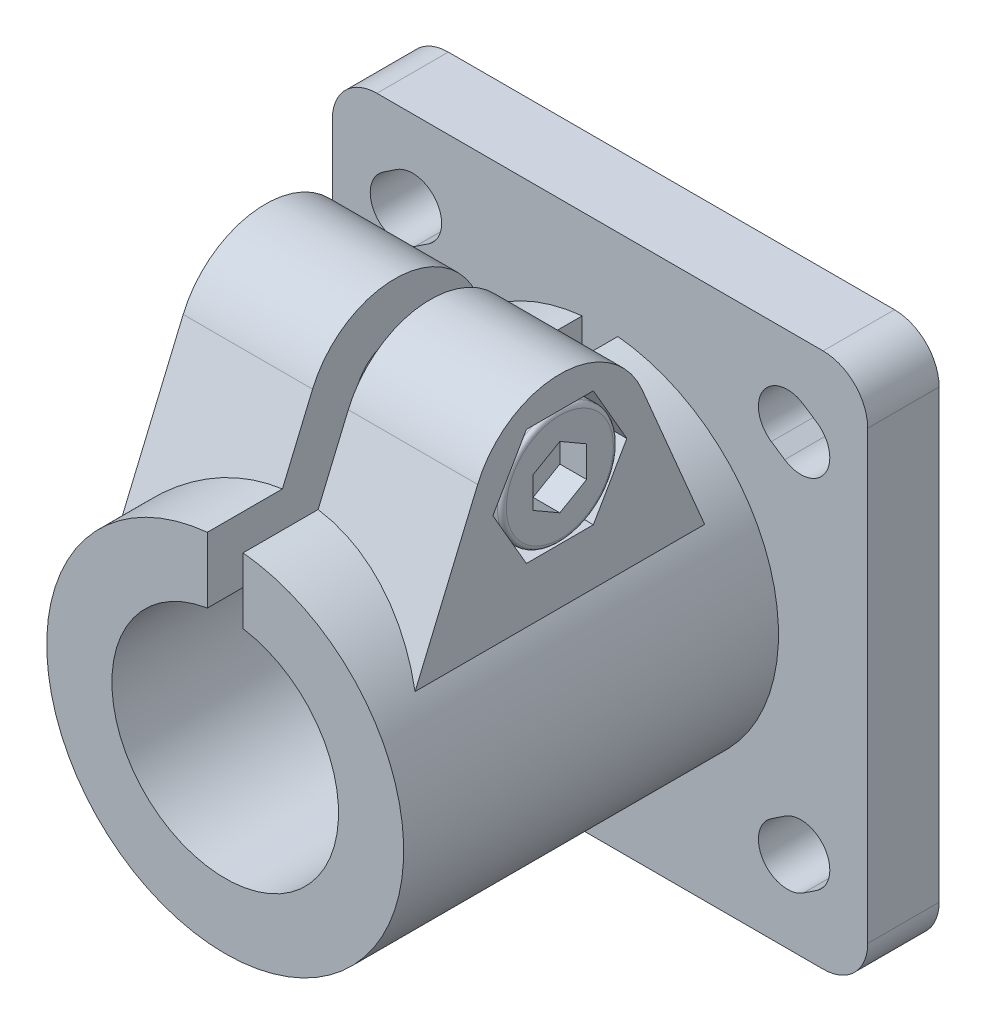
from build123d import *

# Parameters (mm, degrees)
BOSS_EXTRUDE1_DEPTH            = 8
SKETCH4_R                      = 20
BOSS_EXTRUDE2_DEPTH            = 42
BOSS_EXTRUDE3_DEPTH            = 16.5
CUT_EXTRUDE1_REACH             = 69.498
SKETCH6_R                      = 12.7
CUT_EXTRUDE2_START             = -42
CUT_EXTRUDE2_DEPTH             = 42
CUT_EXTRUDE3_REACH             = 69.498
SKETCH8_R                      = 4.5
CUT_EXTRUDE3_DIRECTION_2_REACH = 69.498
CUT_EXTRUDE4_DEPTH             = 8
SKETCH10_R                     = 4
BOSS_EXTRUDE4_DEPTH            = 25
CHAMFER1_SIZE                  = 0.767
CUT_SWEEP1_PITCH               = 1.25
SKETCH13_R                     = 6.5
BOSS_EXTRUDE5_DEPTH            = 8
CUT_EXTRUDE5_DEPTH             = 3
FILLET1_R                      = 0.5
SKETCH15_R                     = 3.3235
BOSS_EXTRUDE6_DEPTH            = 8
CHAMFER2_SIZE                  = 0.4


with BuildPart() as part:
    # Sketch3 → Boss-Extrude1 (new body)
    with BuildSketch(Plane.XY):
        with BuildLine():
            Line((-30, 25), (-30, -25))
            ThreePointArc((-30, -25), (-28.535533906, -28.535533906), (-25, -30))
            Line((-25, -30), (25, -30))
            ThreePointArc((25, -30), (28.535533906, -28.535533906), (30, -25))
            Line((30, -25), (30, 25))
            ThreePointArc((30, 25), (28.535533906, 28.535533906), (25, 30))
            Line((25, 30), (-25, 30))
            ThreePointArc((-25, 30), (-28.535533906, 28.535533906), (-30, 25))
        make_face()
    extrude(amount=BOSS_EXTRUDE1_DEPTH)

    # Sketch4 → Boss-Extrude2 (add)
    with BuildSketch(Plane.XY.offset(8)):
        with Locations(Location((0, 0, 0), (0, 0, 180))):
            Circle(SKETCH4_R)
    extrude(amount=BOSS_EXTRUDE2_DEPTH)

    # Sketch5 → Boss-Extrude3 (add, symmetric)
    with BuildSketch(Plane(origin=(0, 0, 0), x_dir=(0, 0, -1), z_dir=(1, 0, 0))):
        with BuildLine():
            Line((-50, 0), (-38.2110933, 27.893039971))
            ThreePointArc((-38.2110933, 27.893039971), (-29, 34), (-19.7889067, 27.893039971))
            Line((-19.7889067, 27.893039971), (-8, 0))
            Line((-8, 0), (-50, 0))
        make_face()
    extrude(amount=BOSS_EXTRUDE3_DEPTH, both=True)

    # Sketch6 → Cut-Extrude1 (cut, up to next)
    with BuildSketch(Plane.XY, mode=Mode.PRIVATE) as cut_extrude1_sk1:
        Circle(SKETCH6_R)
    cut_extrude1_tool1 = extrude(cut_extrude1_sk1.sketch, amount=CUT_EXTRUDE1_REACH, mode=Mode.PRIVATE) & part.part
    # Sketch6 → Cut-Extrude1 (cut, up to next)
    with BuildSketch(Plane.XY, mode=Mode.PRIVATE) as cut_extrude1_sk2:
        with BuildLine():
            Line((-19.197224362, 18.295836543), (-20.697224362, 17.295836543))
            ThreePointArc((-20.697224362, 17.295836543), (-25.204163457, 18.197224362), (-24.302775638, 22.704163457))
            Line((-24.302775638, 22.704163457), (-22.802775638, 23.704163457))
            ThreePointArc((-22.802775638, 23.704163457), (-18.295836543, 22.802775638), (-19.197224362, 18.295836543))
        make_face()
    cut_extrude1_tool2 = extrude(cut_extrude1_sk2.sketch, amount=CUT_EXTRUDE1_REACH, mode=Mode.PRIVATE) & part.part
    # Sketch6 → Cut-Extrude1 (cut, up to next)
    with BuildSketch(Plane.XY, mode=Mode.PRIVATE) as cut_extrude1_sk3:
        with BuildLine():
            Line((24.302775638, 22.704163457), (22.802775638, 23.704163457))
            ThreePointArc((22.802775638, 23.704163457), (18.295836543, 22.802775638), (19.197224362, 18.295836543))
            Line((19.197224362, 18.295836543), (20.697224362, 17.295836543))
            ThreePointArc((20.697224362, 17.295836543), (25.204163457, 18.197224362), (24.302775638, 22.704163457))
        make_face()
    cut_extrude1_tool3 = extrude(cut_extrude1_sk3.sketch, amount=CUT_EXTRUDE1_REACH, mode=Mode.PRIVATE) & part.part
    # Sketch6 → Cut-Extrude1 (cut, up to next)
    with BuildSketch(Plane.XY, mode=Mode.PRIVATE) as cut_extrude1_sk4:
        with BuildLine():
            Line((22.802775638, -23.704163457), (24.302775638, -22.704163457))
            ThreePointArc((24.302775638, -22.704163457), (25.204163457, -18.197224362), (20.697224362, -17.295836543))
            Line((20.697224362, -17.295836543), (19.197224362, -18.295836543))
            ThreePointArc((19.197224362, -18.295836543), (18.295836543, -22.802775638), (22.802775638, -23.704163457))
        make_face()
    cut_extrude1_tool4 = extrude(cut_extrude1_sk4.sketch, amount=CUT_EXTRUDE1_REACH, mode=Mode.PRIVATE) & part.part
    # Sketch6 → Cut-Extrude1 (cut, up to next)
    with BuildSketch(Plane.XY, mode=Mode.PRIVATE) as cut_extrude1_sk5:
        with BuildLine():
            Line((-24.302775638, -22.704163457), (-22.802775638, -23.704163457))
            ThreePointArc((-22.802775638, -23.704163457), (-18.295836543, -22.802775638), (-19.197224362, -18.295836543))
            Line((-19.197224362, -18.295836543), (-20.697224362, -17.295836543))
            ThreePointArc((-20.697224362, -17.295836543), (-25.204163457, -18.197224362), (-24.302775638, -22.704163457))
        make_face()
    cut_extrude1_tool5 = extrude(cut_extrude1_sk5.sketch, amount=CUT_EXTRUDE1_REACH, mode=Mode.PRIVATE) & part.part
    add(cut_extrude1_tool1.solids().sort_by_distance((0, 0, 0))[0], mode=Mode.SUBTRACT)
    add(cut_extrude1_tool2.solids().sort_by_distance((-21.75, 20.5, 0))[0], mode=Mode.SUBTRACT)
    add(cut_extrude1_tool3.solids().sort_by_distance((21.75, 20.5, 0))[0], mode=Mode.SUBTRACT)
    add(cut_extrude1_tool4.solids().sort_by_distance((21.75, -20.5, 0))[0], mode=Mode.SUBTRACT)
    add(cut_extrude1_tool5.solids().sort_by_distance((-21.75, -20.5, 0))[0], mode=Mode.SUBTRACT)

    # Sketch7 → Cut-Extrude2 (cut)
    with BuildSketch(Plane.XY.offset(50).offset(CUT_EXTRUDE2_START)):
        with BuildLine():
            Line((-2, 34), (2, 34))
            Line((2, 34), (2, 12.541531007))
            ThreePointArc((2, 12.541531007), (0, 12.7), (-2, 12.541531007))
            Line((-2, 12.541531007), (-2, 34))
        make_face()
    extrude(amount=CUT_EXTRUDE2_DEPTH, mode=Mode.SUBTRACT)

    # Sketch8 → Cut-Extrude3 (cut, up to next)
    with BuildSketch(Plane(origin=(0, 0, 0), x_dir=(0, 0, -1), z_dir=(1, 0, 0)), mode=Mode.PRIVATE) as cut_extrude3_sk1:
        with Locations(Location((-29, 24, 0), (0, 0, 180))):
            Circle(SKETCH8_R)
    cut_extrude3_tool1 = extrude(cut_extrude3_sk1.sketch, amount=-CUT_EXTRUDE3_REACH, mode=Mode.PRIVATE) & part.part
    add(cut_extrude3_tool1.solids().sort_by_distance((0, 24, 29))[0], mode=Mode.SUBTRACT)

    # Sketch8 → Cut-Extrude3 direction 2 (cut, up to next)
    with BuildSketch(Plane(origin=(0, 0, 0), x_dir=(0, 0, -1), z_dir=(1, 0, 0)), mode=Mode.PRIVATE) as cut_extrude3_direction_2_sk1:
        with Locations(Location((-29, 24, 0), (0, 0, 180))):
            Circle(SKETCH8_R)
    cut_extrude3_direction_2_tool1 = extrude(cut_extrude3_direction_2_sk1.sketch, amount=CUT_EXTRUDE3_DIRECTION_2_REACH, mode=Mode.PRIVATE) & part.part
    add(cut_extrude3_direction_2_tool1.solids().sort_by_distance((0, 24, 29))[0], mode=Mode.SUBTRACT)

    # Sketch9 → Cut-Extrude4 (cut)
    with BuildSketch(Plane(origin=(16.5, 0, 0), x_dir=(0, 0, -1), z_dir=(1, 0, 0))):
        Polygon((-32.75277675, 30.5), (-36.505553499, 24), (-32.75277675, 17.5), (-25.24722325, 17.5), (-21.494446501, 24), (-25.24722325, 30.5), align=None)
    cut_extrude4 = extrude(amount=-CUT_EXTRUDE4_DEPTH, mode=Mode.SUBTRACT)

    # Mirror1: Cut-Extrude4 across plane
    add(cut_extrude4.mirror(Plane(origin=(0, 0, 0), x_dir=(0, 0, 1), z_dir=(1, 0, 0))), mode=Mode.SUBTRACT)


with BuildPart() as body_2:
    # Sketch10 → Boss-Extrude4 (new body)
    with BuildSketch(Plane(origin=(8.5, 0, 0), x_dir=(0, 0, -1), z_dir=(1, 0, 0))):
        with Locations((-29, 24)):
            Circle(SKETCH10_R)
    extrude(amount=-BOSS_EXTRUDE4_DEPTH)

    # Chamfer1
    chamfer1_edges = [body_2.edges().sort_by_distance(p)[0] for p in [
        (-16.5, 24, 33),
    ]]
    chamfer(chamfer1_edges, length=CHAMFER1_SIZE)

    # Cut-Sweep1: arcs per turn and ends read off the stored shape
    # Cut-Sweep1: the profile of Sketch12 screwed along a right-hand helix through 21 turns, 8 arcs to a turn; built about Z, then put on its axis
    cut_sweep1_z = Axis((0, 0, 0), (0, 0, 1))
    cut_sweep1_corners = [(4.067658235, 0, -1.1328125), (3.188101184, 0, -0.625), (3.188101184, 0, -0.46875), (4.067658235, 0, 0.0390625)]
    with BuildLine(mode=Mode.PRIVATE) as cut_sweep1_profile:
        Line(cut_sweep1_corners[0], cut_sweep1_corners[1])
        Line(cut_sweep1_corners[1], cut_sweep1_corners[2])
        Line(cut_sweep1_corners[2], cut_sweep1_corners[3])
        Line(cut_sweep1_corners[3], cut_sweep1_corners[0])
    cut_sweep1_cap = Face(cut_sweep1_profile.wire())
    cut_sweep1_turn_angles = [0, 22.5, 45, 67.5, 90, 112.5, 135, 157.5, 180, 202.5, 225, 247.5, 270, 292.5, 315, 337.5, 360]
    cut_sweep1_turn_weights = [1, 0.9238795325112867, 1, 0.9238795325112867, 1, 0.9238795325112867, 1, 0.9238795325112867, 1, 0.9238795325112867, 1, 0.9238795325112867, 1, 0.9238795325112867, 1, 0.9238795325112867, 1]
    cut_sweep1_turn_rails = [Edge.make_bspline([Vector(p[0], p[1], 0).rotate(cut_sweep1_z, cut_sweep1_turn_angles[k]) / cut_sweep1_turn_weights[k] + Vector(0, 0, p[2] + CUT_SWEEP1_PITCH * cut_sweep1_turn_angles[k] / 360) for k in range(17)], [0, 0, 0, 1, 1, 2, 2, 3, 3, 4, 4, 5, 5, 6, 6, 7, 7, 8, 8, 8], 2, cut_sweep1_turn_weights) for p in cut_sweep1_corners]
    cut_sweep1_turn_sides = [Face.make_surface_from_curves(cut_sweep1_turn_rails[p[0]], cut_sweep1_turn_rails[p[1]]) for p in [(0, 1), (1, 2), (2, 3), (3, 0)]]
    cut_sweep1 = Plane(origin=(-16.5, 24, 29), x_dir=(0, 1, 0), z_dir=(1, 0, 0)) * Solid(Shell([*[p.moved(Location((0, 0, CUT_SWEEP1_PITCH * i))) for i in range(21) for p in cut_sweep1_turn_sides], cut_sweep1_cap, cut_sweep1_cap.rotate(cut_sweep1_z, 7560).moved(Location((0, 0, CUT_SWEEP1_PITCH * 7560 / 360)))]))
    add(cut_sweep1, mode=Mode.SUBTRACT)

    # Sketch13 → Boss-Extrude5 (add)
    with BuildSketch(Plane(origin=(8.5, 0, 0), x_dir=(0, 0, -1), z_dir=(1, 0, 0))):
        with Locations((-29, 24)):
            Circle(SKETCH13_R)
    extrude(amount=BOSS_EXTRUDE5_DEPTH)

    # Sketch14 → Cut-Extrude5 (cut)
    with BuildSketch(Plane(origin=(16.5, 0, 0), x_dir=(0, 0, -1), z_dir=(1, 0, 0))):
        Polygon((-29, 27.464101615), (-32, 25.732050808), (-32, 22.267949192), (-29, 20.535898385), (-26, 22.267949192), (-26, 25.732050808), align=None)
    extrude(amount=-CUT_EXTRUDE5_DEPTH, mode=Mode.SUBTRACT)

    # Fillet1
    fillet1_edges = [body_2.edges().sort_by_distance(p)[0] for p in [
        (8.5, 24, 35.5),
        (16.5, 24, 35.5),
    ]]
    fillet(fillet1_edges, radius=FILLET1_R)


with BuildPart() as body_3:
    # Sketch15 → Boss-Extrude6 (new body)
    with BuildSketch(Plane.ZY.offset(8.5)):
        Polygon((36.505553499, 24), (32.75277675, 30.5), (25.24722325, 30.5), (21.494446501, 24), (25.24722325, 17.5), (32.75277675, 17.5), align=None)
        with Locations((29, 24)):
            Circle(SKETCH15_R, mode=Mode.SUBTRACT)
    extrude(amount=BOSS_EXTRUDE6_DEPTH)

    # Sketch16 → Cut-Revolve1 (revolve, cut)
    with BuildSketch(Plane.XY.offset(29), mode=Mode.PRIVATE) as cut_revolve1_sk:
        Polygon((-8.5, 31.505553499), (-8.5, 30.5), (-8.769437248, 31.505553499), align=None)
        with BuildLine():
            Line((-13.730562752, 31.505553499), (-14, 31.505553499))
            Line((-14, 31.505553499), (-16.5, 31.505553499))
            Line((-16.5, 31.505553499), (-16.5, 28.896439888))
            ThreePointArc((-16.5, 28.896439888), (-16.427398049, 29.155921887), (-16.230676368, 29.340048288))
            Line((-16.230676368, 29.340048288), (-14, 30.5))
            Line((-14, 30.5), (-13.730562752, 31.505553499))
        make_face()
    revolve(cut_revolve1_sk.sketch.rotate(Axis((-8.5, 24, 29), (-1, 0, 0)), 90), axis=Axis((-8.5, 24, 29), (-1, 0, 0)), mode=Mode.SUBTRACT)

    # Chamfer2
    chamfer2_edges = [body_3.edges().sort_by_distance(p)[0] for p in [
        (-8.5, 24, 25.6765),
        (-16.5, 24, 25.6765),
    ]]
    chamfer(chamfer2_edges, length=CHAMFER2_SIZE)


solid = Compound([part.part, body_2.part, body_3.part])
